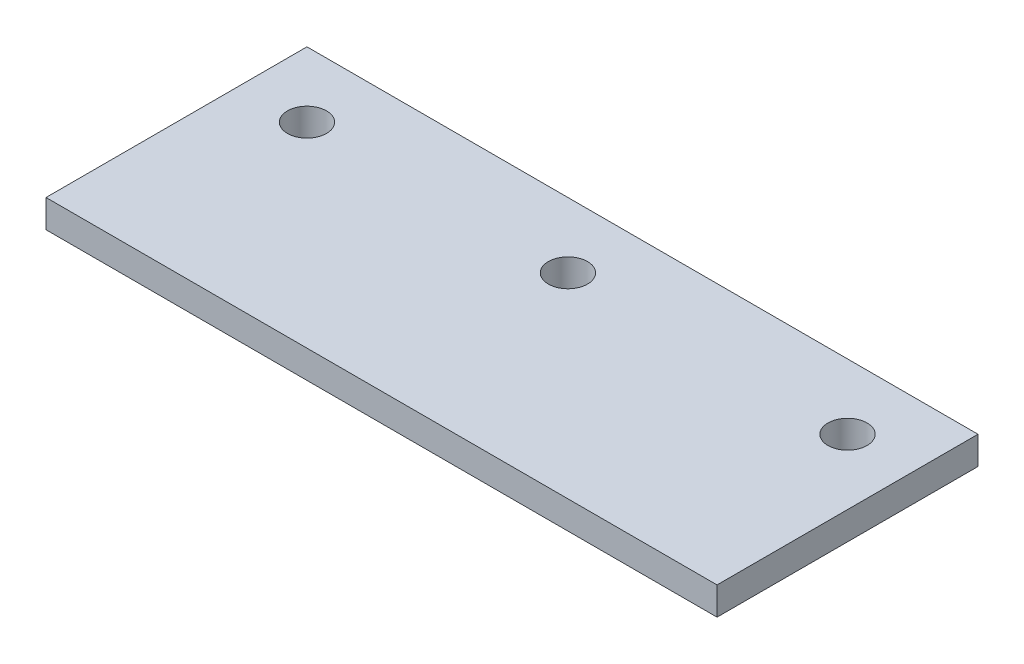
from build123d import *

# Parameters (mm, degrees)
SKETCH1_W           = 72
SKETCH1_H           = 28
SKETCH1_R           = 2.1
BOSS_EXTRUDE1_DEPTH = 3


with BuildPart() as part:
    # Sketch1 → Boss-Extrude1 (new body)
    with BuildSketch(Plane(origin=(0, 0, 0), x_dir=(1, 0, 0), z_dir=(0, 1, 0))):
        with Locations((36, -14)):
            Rectangle(SKETCH1_W, SKETCH1_H)
        with Locations((7, -7)):
            Circle(SKETCH1_R, mode=Mode.SUBTRACT)
        with Locations((35, -7)):
            Circle(SKETCH1_R, mode=Mode.SUBTRACT)
        with Locations((65, -7)):
            Circle(SKETCH1_R, mode=Mode.SUBTRACT)
    extrude(amount=BOSS_EXTRUDE1_DEPTH)


solid = part.part
